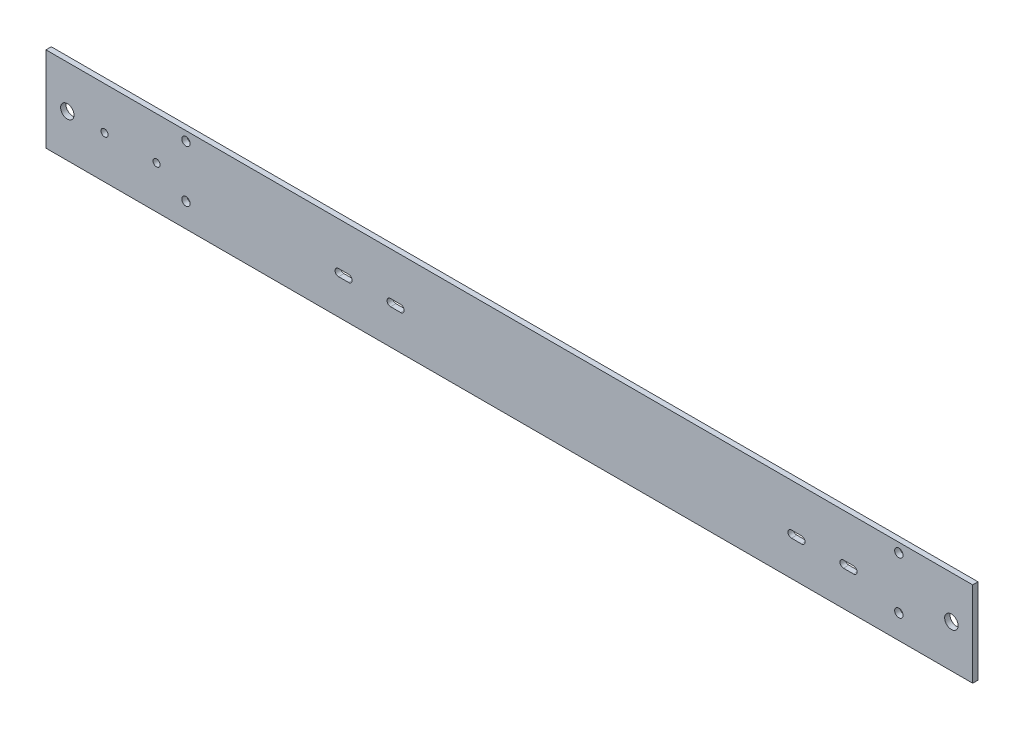
from build123d import *

# Parameters (mm, degrees)
SKETCH1_W                    = 3.175
SKETCH1_H                    = 50.8
BOSS_EXTRUDE1_DEPTH          = 552.45
SIDEHOLES_SKETCH4_R          = 4
SIDEHOLES_SKETCH4_R_2        = 2.5
SIDEHOLES_SKETCH4_R_3        = 2.1
SIDEHOLES_CUT_EXTRUDE3_DEPTH = 555.789800848


with BuildPart() as part:
    # Sketch1 → Boss-Extrude1 (new body)
    with BuildSketch(Plane(origin=(0, 0, 0), x_dir=(0, 0, -1), z_dir=(1, 0, 0))):
        with Locations((-1.5875, 25.4)):
            Rectangle(SKETCH1_W, SKETCH1_H)
    extrude(amount=BOSS_EXTRUDE1_DEPTH)

    # SideHoles-Sketch4 → SideHoles-Cut-Extrude3 (cut, through all)
    with BuildSketch(Plane.XY.offset(3.175)):
        with Locations((12.7, 25.4)):
            Circle(SIDEHOLES_SKETCH4_R)
        with Locations((539.75, 25.4)):
            Circle(SIDEHOLES_SKETCH4_R)
        with Locations((83.425, 45.3)):
            Circle(SIDEHOLES_SKETCH4_R_2)
        with Locations((83.425, 14.3)):
            Circle(SIDEHOLES_SKETCH4_R_2)
        with Locations((508.425, 45.3)):
            Circle(SIDEHOLES_SKETCH4_R_2)
        with Locations((508.425, 14.3)):
            Circle(SIDEHOLES_SKETCH4_R_2)
        with Locations((34.9, 25.4)):
            Circle(SIDEHOLES_SKETCH4_R_3)
        with Locations((65.9, 25.4)):
            Circle(SIDEHOLES_SKETCH4_R_3)
        with BuildLine():
            Line((444.425, 25.1), (450.425, 25.1))
            ThreePointArc((450.425, 25.1), (452.525, 23), (450.425, 20.9))
            Line((450.425, 20.9), (444.425, 20.9))
            ThreePointArc((444.425, 20.9), (442.325, 23), (444.425, 25.1))
        make_face()
        with BuildLine():
            Line((475.425, 25.1), (481.425, 25.1))
            ThreePointArc((481.425, 25.1), (483.525, 23), (481.425, 20.9))
            Line((481.425, 20.9), (475.425, 20.9))
            ThreePointArc((475.425, 20.9), (473.325, 23), (475.425, 25.1))
        make_face()
        with BuildLine():
            Line((174.425, 25.1), (180.425, 25.1))
            ThreePointArc((180.425, 25.1), (182.525, 23), (180.425, 20.9))
            Line((180.425, 20.9), (174.425, 20.9))
            ThreePointArc((174.425, 20.9), (172.325, 23), (174.425, 25.1))
        make_face()
        with BuildLine():
            Line((205.425, 25.1), (211.425, 25.1))
            ThreePointArc((211.425, 25.1), (213.525, 23), (211.425, 20.9))
            Line((211.425, 20.9), (205.425, 20.9))
            ThreePointArc((205.425, 20.9), (203.325, 23), (205.425, 25.1))
        make_face()
    extrude(amount=-SIDEHOLES_CUT_EXTRUDE3_DEPTH, mode=Mode.SUBTRACT)


solid = part.part
